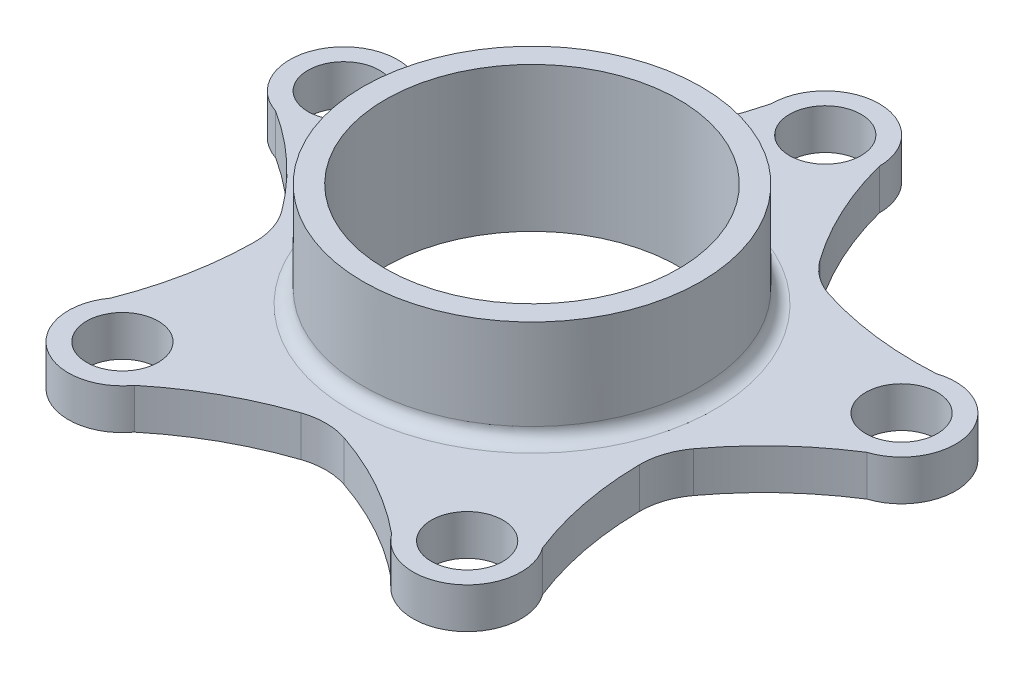
from build123d import *

# Parameters (mm, degrees)
SKETCH1_R                 = 31.75
CENTERCIRCLEEXTRUDE_DEPTH = 19.558
SKETCH2_R                 = 80.01
BASEEXPAND_DEPTH          = 7.62
SKETCH3_R                 = 27.559
CENTERCUT_DEPTH           = 27.178
SKETCH4_R                 = 6.731
OUTERCIRCLECUT_DEPTH      = 7.62
SKETCH8_R                 = 80.01
STARFISHCUT_DEPTH         = 7.62
FILLET8_R                 = 2.54
FILLET10_R                = 12.7


with BuildPart() as part:
    # Sketch1 → CenterCircleExtrude (new body)
    with BuildSketch(Plane(origin=(0, 0, 0), x_dir=(1, 0, 0), z_dir=(0, 1, 0))):
        Circle(SKETCH1_R)
    extrude(amount=CENTERCIRCLEEXTRUDE_DEPTH)

    # Sketch2 → BaseExpand (add)
    with BuildSketch(Plane.XZ):
        Circle(SKETCH2_R)
    extrude(amount=BASEEXPAND_DEPTH)

    # Sketch3 → CenterCut (cut)
    with BuildSketch(Plane(origin=(0, 19.558, 0), x_dir=(1, 0, 0), z_dir=(0, 1, 0))):
        Circle(SKETCH3_R)
    extrude(amount=-CENTERCUT_DEPTH, mode=Mode.SUBTRACT)

    # Sketch4 → OuterCircleCut (cut)
    with BuildSketch(Plane(origin=(0, 0, 0), x_dir=(1, 0, 0), z_dir=(0, 1, 0))):
        with Locations((0, 55.118)):
            Circle(SKETCH4_R)
        with Locations((52.420333065, 17.032398696)):
            Circle(SKETCH4_R)
        with Locations((32.397547536, -44.591398696)):
            Circle(SKETCH4_R)
        with Locations((-32.397547536, -44.591398696)):
            Circle(SKETCH4_R)
        with Locations((-52.420333065, 17.032398696)):
            Circle(SKETCH4_R)
    extrude(amount=-OUTERCIRCLECUT_DEPTH, mode=Mode.SUBTRACT)

    # Sketch8 → StarfishCut (cut)
    with BuildSketch(Plane(origin=(0, 0, 0), x_dir=(1, 0, 0), z_dir=(0, 1, 0))):
        Circle(SKETCH8_R)
        with BuildLine():
            ThreePointArc((-55.559945728, 7.36966449), (-62.083067271, 20.172011359), (-49.280720402, 26.695132902))
            ThreePointArc((-49.280720402, 26.695132902), (-35.631970511, 27.335423115), (-22.436174146, 30.88074446))
            ThreePointArc((-22.436174146, 30.88074446), (-14.986647849, 42.335128034), (-10.16, 55.118))
            ThreePointArc((-10.16, 55.118), (0, 65.278), (10.16, 55.118))
            ThreePointArc((10.16, 55.118), (14.986647849, 42.335128034), (22.436174146, 30.88074446))
            ThreePointArc((22.436174146, 30.88074446), (35.631970511, 27.335423115), (49.280720402, 26.695132902))
            ThreePointArc((49.280720402, 26.695132902), (58.392231228, 25.252011359), (62.580333065, 17.032398696))
            ThreePointArc((62.580333065, 17.032398696), (60.639945728, 11.060500533), (55.559945728, 7.36966449))
            ThreePointArc((55.559945728, 7.36966449), (44.894228259, -1.170875072), (36.302492346, -11.795394786))
            ThreePointArc((36.302492346, -11.795394786), (37.008416711, -25.440907452), (40.617160199, -38.619500533))
            ThreePointArc((40.617160199, -38.619500533), (42.060281741, -41.451786033), (42.557547536, -44.591398696))
            ThreePointArc((42.557547536, -44.591398696), (35.537160199, -54.254132902), (24.177934873, -50.563296859))
            ThreePointArc((24.177934873, -50.563296859), (12.759511114, -43.058768626), (0, -38.170699348))
            ThreePointArc((0, -38.170699348), (-12.759511114, -43.058768626), (-24.177934873, -50.563296859))
            ThreePointArc((-24.177934873, -50.563296859), (-38.369445699, -52.811011359), (-40.617160199, -38.619500533))
            ThreePointArc((-40.617160199, -38.619500533), (-37.008416711, -25.440907452), (-36.302492346, -11.795394786))
            ThreePointArc((-36.302492346, -11.795394786), (-44.894228259, -1.170875072), (-55.559945728, 7.36966449))
        make_face(mode=Mode.SUBTRACT)
    extrude(amount=-STARFISHCUT_DEPTH, mode=Mode.SUBTRACT)

    # Fillet8
    fillet8_edges = [part.edges().sort_by_distance(p)[0] for p in [
        (-31.75, 0, 0),
    ]]
    fillet(fillet8_edges, radius=FILLET8_R)

    # Fillet10
    fillet10_edges = [part.edges().sort_by_distance(p)[0] for p in [
        (-22.436174146, -3.81, -30.88074446),
        (-36.302492346, -3.81, 11.795394786),
        (0, -3.81, 38.170699348),
        (36.302492346, -3.81, 11.795394786),
        (22.436174146, -3.81, -30.88074446),
    ]]
    fillet(fillet10_edges, radius=FILLET10_R)


solid = part.part
